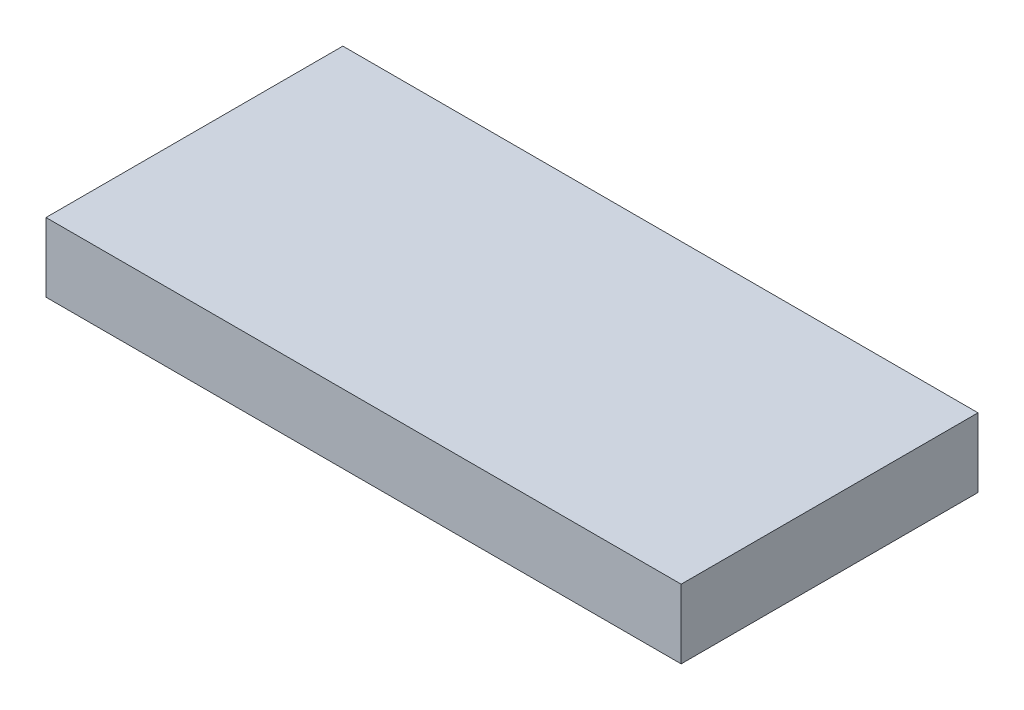
from build123d import *

# Parameters (mm, degrees)
SKETCH1_W           = 184
SKETCH1_H           = 86
BOSS_EXTRUDE1_DEPTH = 20
SKETCH2_R           = 5.8
CUT_EXTRUDE1_DEPTH  = 5.2


with BuildPart() as part:
    # Sketch1 → Boss-Extrude1 (new body)
    with BuildSketch(Plane(origin=(0, 0, 0), x_dir=(1, 0, 0), z_dir=(0, 1, 0))):
        Rectangle(SKETCH1_W, SKETCH1_H)
    extrude(amount=BOSS_EXTRUDE1_DEPTH)

    # Sketch2 → Cut-Extrude1 (cut)
    with BuildSketch(Plane.XZ):
        Circle(SKETCH2_R)
    extrude(amount=-CUT_EXTRUDE1_DEPTH, mode=Mode.SUBTRACT)


solid = part.part
